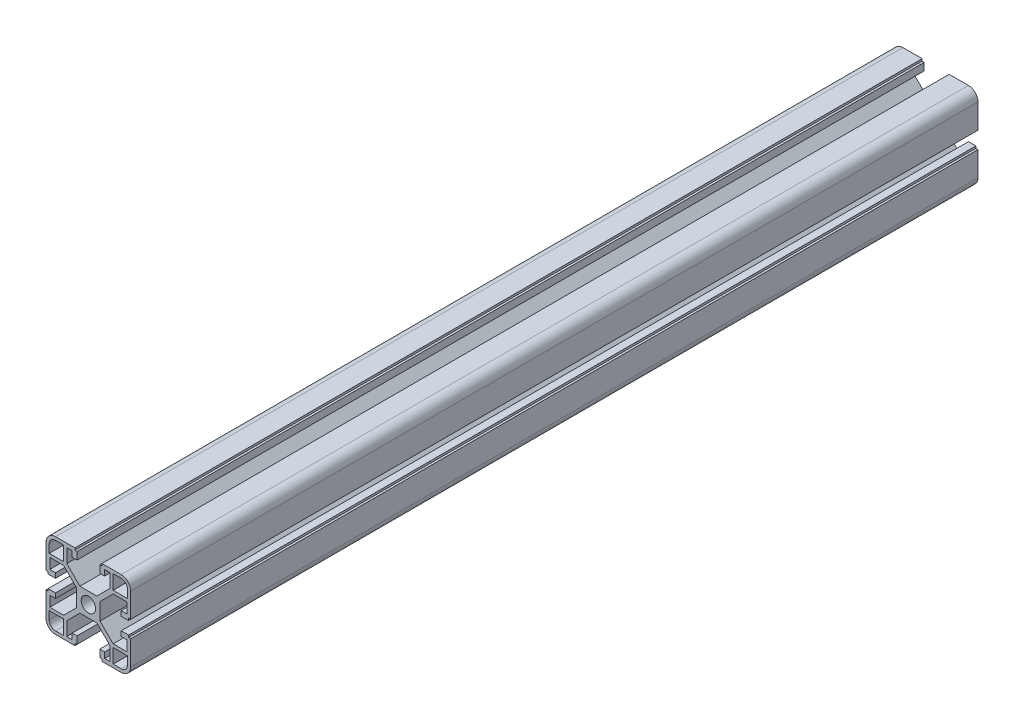
from build123d import *
from build123d.topology import SkipClean

# Parameters (mm, degrees)
BOSS_EXTRUDE1_DEPTH  = 400
MIRROR3_COPY_1_DEPTH = 400
MIRROR3_COPY_2_DEPTH = 400


with BuildPart() as part:
    # Sketch1 → Boss-Extrude1 (new body)
    with BuildSketch(Plane.XY):
        with BuildLine():
            Line((3.4, 0), (5.5, 0))
            Line((5.5, 0), (5.5, 4))
            Line((5.5, 4), (11.69, 10.19))
            Line((11.69, 10.19), (18.2, 10.19))
            Line((18.2, 10.19), (18.2, 5.265595036))
            Line((18.2, 5.265595036), (15.5, 5.265595036))
            Line((15.5, 5.265595036), (15.5, 2.965595036))
            Line((15.5, 2.965595036), (19, 2.965595036))
            Line((19, 2.965595036), (19, 3.965595036))
            Line((19, 3.965595036), (20, 3.965595036))
            Line((20, 3.965595036), (20, 15.5))
            ThreePointArc((20, 15.5), (18.681980515, 18.681980515), (15.5, 20))
            Line((15.5, 20), (6.385304712, 20))
            Line((6.385304712, 20), (6.385304712, 19))
            Line((6.385304712, 19), (5.385304712, 19))
            Line((5.385304712, 19), (5.385304712, 15.5))
            Line((5.385304712, 15.5), (7.685304712, 15.5))
            Line((7.685304712, 15.5), (7.685304712, 18.2))
            Line((7.685304712, 18.2), (10.19, 18.2))
            Line((10.19, 18.2), (10.19, 11.69))
            Line((10.19, 11.69), (4, 5.5))
            Line((4, 5.5), (0, 5.5))
            Line((0, 5.5), (0, 3.4))
            ThreePointArc((0, 3.4), (2.404163056, 2.404163056), (3.4, 0))
        make_face()
        with BuildLine():
            Line((18.5, 11.69), (18.5, 15.5))
            ThreePointArc((18.5, 15.5), (17.621320344, 17.621320344), (15.5, 18.5))
            Line((15.5, 18.5), (11.69, 18.5))
            Line((11.69, 18.5), (11.69, 11.69))
            Line((11.69, 11.69), (18.5, 11.69))
        make_face(mode=Mode.SUBTRACT)
    boss_extrude1 = extrude(amount=BOSS_EXTRUDE1_DEPTH)

    # Mirror1: Boss-Extrude1 across plane
    add(boss_extrude1.mirror(Plane.ZX))

    # Mirror2: Boss-Extrude1 across plane
    add(boss_extrude1.mirror(Plane(origin=(0, 0, 0), x_dir=(0, 0, 1), z_dir=(1, 0, 0))))

    # Mirror3 copy 1 sketch → Mirror3 copy 1 (add)
    with BuildSketch(Plane(origin=(0, 0, 0), x_dir=(-1, 0, 0), z_dir=(0, 0, 1))):
        with BuildLine():
            Line((3.4, 0), (5.5, 0))
            Line((5.5, 0), (5.5, 4))
            Line((5.5, 4), (11.69, 10.19))
            Line((11.69, 10.19), (18.2, 10.19))
            Line((18.2, 10.19), (18.2, 5.265595036))
            Line((18.2, 5.265595036), (15.5, 5.265595036))
            Line((15.5, 5.265595036), (15.5, 2.965595036))
            Line((15.5, 2.965595036), (19, 2.965595036))
            Line((19, 2.965595036), (19, 3.965595036))
            Line((19, 3.965595036), (20, 3.965595036))
            Line((20, 3.965595036), (20, 15.5))
            ThreePointArc((20, 15.5), (18.681980515, 18.681980515), (15.5, 20))
            Line((15.5, 20), (6.385304712, 20))
            Line((6.385304712, 20), (6.385304712, 19))
            Line((6.385304712, 19), (5.385304712, 19))
            Line((5.385304712, 19), (5.385304712, 15.5))
            Line((5.385304712, 15.5), (7.685304712, 15.5))
            Line((7.685304712, 15.5), (7.685304712, 18.2))
            Line((7.685304712, 18.2), (10.19, 18.2))
            Line((10.19, 18.2), (10.19, 11.69))
            Line((10.19, 11.69), (4, 5.5))
            Line((4, 5.5), (0, 5.5))
            Line((0, 5.5), (0, 3.4))
            ThreePointArc((0, 3.4), (2.404163056, 2.404163056), (3.4, 0))
        make_face()
        with BuildLine():
            Line((18.5, 11.69), (18.5, 15.5))
            ThreePointArc((18.5, 15.5), (17.621320344, 17.621320344), (15.5, 18.5))
            Line((15.5, 18.5), (11.69, 18.5))
            Line((11.69, 18.5), (11.69, 11.69))
            Line((11.69, 11.69), (18.5, 11.69))
        make_face(mode=Mode.SUBTRACT)
    extrude(amount=MIRROR3_COPY_1_DEPTH)

    # Mirror3 copy 2 sketch → Mirror3 copy 2 (add)
    with SkipClean():  # the faces are left unmerged after this step: merging them gives an invalid solid
        with BuildSketch(Plane.XY):
            with BuildLine():
                Line((3.4, 0), (5.5, 0))
                Line((5.5, 0), (5.5, -4))
                Line((5.5, -4), (11.69, -10.19))
                Line((11.69, -10.19), (18.2, -10.19))
                Line((18.2, -10.19), (18.2, -5.265595036))
                Line((18.2, -5.265595036), (15.5, -5.265595036))
                Line((15.5, -5.265595036), (15.5, -2.965595036))
                Line((15.5, -2.965595036), (19, -2.965595036))
                Line((19, -2.965595036), (19, -3.965595036))
                Line((19, -3.965595036), (20, -3.965595036))
                Line((20, -3.965595036), (20, -15.5))
                ThreePointArc((20, -15.5), (18.681980515, -18.681980515), (15.5, -20))
                Line((15.5, -20), (6.385304712, -20))
                Line((6.385304712, -20), (6.385304712, -19))
                Line((6.385304712, -19), (5.385304712, -19))
                Line((5.385304712, -19), (5.385304712, -15.5))
                Line((5.385304712, -15.5), (7.685304712, -15.5))
                Line((7.685304712, -15.5), (7.685304712, -18.2))
                Line((7.685304712, -18.2), (10.19, -18.2))
                Line((10.19, -18.2), (10.19, -11.69))
                Line((10.19, -11.69), (4, -5.5))
                Line((4, -5.5), (0, -5.5))
                Line((0, -5.5), (0, -3.4))
                ThreePointArc((0, -3.4), (2.404163056, -2.404163056), (3.4, 0))
            make_face()
            with BuildLine():
                Line((18.5, -11.69), (18.5, -15.5))
                ThreePointArc((18.5, -15.5), (17.621320344, -17.621320344), (15.5, -18.5))
                Line((15.5, -18.5), (11.69, -18.5))
                Line((11.69, -18.5), (11.69, -11.69))
                Line((11.69, -11.69), (18.5, -11.69))
            make_face(mode=Mode.SUBTRACT)
        extrude(amount=MIRROR3_COPY_2_DEPTH)


solid = part.part
